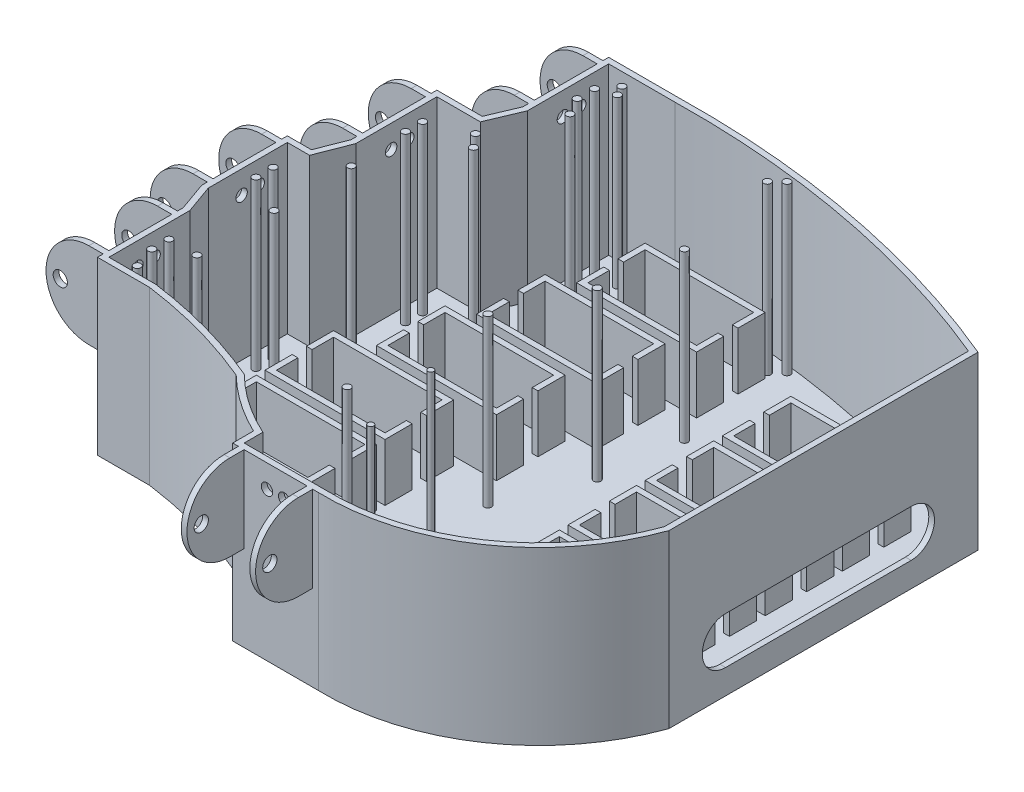
from build123d import *

# Parameters (mm, degrees)
BOSS_EXTRUDE1_DEPTH       = 38.1
CUT_EXTRUDE1_DEPTH        = 36.83
BOSS_EXTRUDE2_DEPTH       = 13.97
BOSS_EXTRUDE3_DEPTH       = 13.97
BOSS_EXTRUDE4_DEPTH       = 13.97
BOSS_EXTRUDE5_DEPTH       = 13.97
BOSS_EXTRUDE6_DEPTH       = 13.97
BOSS_EXTRUDE7_DEPTH       = 13.97
BOSS_EXTRUDE8_DEPTH       = 13.97
BOSS_EXTRUDE9_DEPTH       = 13.97
BOSS_EXTRUDE10_DEPTH      = 13.97
BOSS_EXTRUDE11_DEPTH      = 13.97
SKETCH25_R                = 1.27
THUMB_HOLES_DEPTH         = 12.7
SKETCH31_R                = 1.27
INDEX_FINGER_HOLES_DEPTH  = 17.018
SKETCH32_R                = 1.27
MIDDLE_FINGER_HOLES_DEPTH = 15.24
SKETCH33_R                = 1.27
RING_FINGER_HOLES_DEPTH   = 22.86
SKETCH34_R                = 1.27
PINKY_FINGER_HOLES_DEPTH  = 35.56
SKETCH26_R                = 0.635
SKETCH26_R_2              = 0.79375
GUIDE_POLES_DEPTH         = 36.83
SKETCH35_R                = 1.5875
PINKY_ATTACHMENT_DEPTH    = 19.05
SKETCH36_R                = 1.5875
RING_ATTACHMENT_DEPTH     = 19.05
SKETCH37_R                = 1.5875
MIDDLE_ATTACHMENT_DEPTH   = 19.05
SKETCH38_R                = 1.5875
POINTER_ATTACHMENT_DEPTH  = 19.05
SKETCH39_R                = 1.5875
THUMB_ATTACHMENT_DEPTH    = 19.05
ATTACHMENT_TRIM_DEPTH     = 25.4
CORD_HOLE_DEPTH           = 5.08


with BuildPart() as part:
    # Sketch2 → Boss-Extrude1 (new body)
    with BuildSketch(Plane(origin=(0, 0, 0), x_dir=(1, 0, 0), z_dir=(0, 1, 0))):
        with BuildLine():
            Line((-20.778406205, 52.758673202), (-36.188953289, 52.758673202))
            Line((-36.188953289, 52.758673202), (-36.188953289, 33.708673202))
            Line((-36.188953289, 33.708673202), (-38.864171838, 27.358673202))
            Line((-38.864171838, 27.358673202), (-48.947687906, 27.358673202))
            Line((-48.947687906, 27.358673202), (-48.947687906, 8.308673202))
            Line((-48.947687906, 8.308673202), (-51.417120413, 1.958673202))
            Line((-51.417120413, 1.958673202), (-56.767557511, 1.958673202))
            Line((-56.767557511, 1.958673202), (-56.767557511, -17.091326798))
            Line((-56.767557511, -17.091326798), (-54.503911047, -23.441326798))
            Line((-54.503911047, -23.441326798), (-54.503911047, -42.491326798))
            Line((-54.503911047, -42.491326798), (-42.959403849, -42.491326798))
            ThreePointArc((-42.959403849, -42.491326798), (-29.448791922, -45.239401215), (-16.422067996, -49.755263412))
            ThreePointArc((-16.422067996, -49.755263412), (-10.441569813, -54.6928899), (-3.738179712, -58.593027718))
            Line((-3.738179712, -58.593027718), (-3.738179712, -63.210333869))
            Line((-3.738179712, -63.210333869), (15.311820288, -63.210333869))
            ThreePointArc((15.311820288, -63.210333869), (43.592945253, -54.934630767), (61.572422141, -31.588374066))
            Line((61.572422141, -31.588374066), (61.572422141, 37.055318004))
            ThreePointArc((61.572422141, 37.055318004), (21.220515188, 49.225595088), (-20.778406205, 52.758673202))
        make_face()
    extrude(amount=BOSS_EXTRUDE1_DEPTH)

    # Sketch3 → Cut-Extrude1 (cut)
    with BuildSketch(Plane(origin=(0, 38.1, 0), x_dir=(1, 0, 0), z_dir=(0, 1, 0))):
        with BuildLine():
            Line((-20.193208334, 51.499667825), (-34.918953289, 51.499667825))
            Line((-34.918953289, 51.499667825), (-34.918953289, 33.452072477))
            Line((-34.918953289, 33.452072477), (-38.021111135, 26.088673202))
            Line((-38.021111135, 26.088673202), (-47.677687906, 26.088673202))
            Line((-47.677687906, 26.088673202), (-47.677687906, 8.070420839))
            Line((-47.677687906, 8.070420839), (-50.548353666, 0.688673202))
            Line((-50.548353666, 0.688673202), (-55.497557511, 0.688673202))
            Line((-55.497557511, 0.688673202), (-55.497557511, -16.871730038))
            Line((-55.497557511, -16.871730038), (-53.233911047, -23.221730038))
            Line((-53.233911047, -23.221730038), (-53.233911047, -41.221326798))
            Line((-53.233911047, -41.221326798), (-42.874353316, -41.221326798))
            ThreePointArc((-42.874353316, -41.221326798), (-29.038510393, -44.035017068), (-15.705342229, -48.67980221))
            ThreePointArc((-15.705342229, -48.67980221), (-9.484723257, -53.810670952), (-2.468179712, -57.784338167))
            Line((-2.468179712, -57.784338167), (-2.468179712, -61.940333869))
            Line((-2.468179712, -61.940333869), (15.331165443, -61.940333869))
            ThreePointArc((15.331165443, -61.940333869), (42.778545869, -53.952784334), (60.302422141, -31.367979704))
            Line((60.302422141, -31.367979704), (60.302422141, 36.20914612))
            ThreePointArc((60.302422141, 36.20914612), (20.842965823, 48.004654395), (-20.193208334, 51.499667825))
        make_face()
    extrude(amount=-CUT_EXTRUDE1_DEPTH, mode=Mode.SUBTRACT)

    # Sketch6 → Boss-Extrude2 (add)
    with BuildSketch(Plane(origin=(0, 0, 0), x_dir=(1, 0, 0), z_dir=(0, 1, 0))):
        Polygon((-38.295888343, -32.597001669), (-37.025888343, -32.597001669), (-37.025888343, -37.359501669), (-12.895888343, -37.359501669), (-12.895888343, -32.597001669), (-11.625888343, -32.597001669), (-11.625888343, -38.629501669), (-38.295888343, -38.629501669), align=None)
        Polygon((-12.895888343, -24.659501669), (-37.025888343, -24.659501669), (-37.025888343, -29.422001669), (-38.295888343, -29.422001669), (-38.295888343, -23.389501669), (-11.625888343, -23.389501669), (-11.625888343, -29.422001669), (-12.895888343, -29.422001669), align=None)
    extrude(amount=BOSS_EXTRUDE2_DEPTH)

    # Sketch7 → Boss-Extrude3 (add)
    with BuildSketch(Plane(origin=(0, 0, 0), x_dir=(1, 0, 0), z_dir=(0, 1, 0))):
        Polygon((-38.295888343, -15.452001669), (-37.025888343, -15.452001669), (-37.025888343, -20.214501669), (-12.895888343, -20.214501669), (-12.895888343, -15.452001669), (-11.625888343, -15.452001669), (-11.625888343, -21.484501669), (-38.295888343, -21.484501669), align=None)
        Polygon((-12.895888343, -7.514501669), (-37.025888343, -7.514501669), (-37.025888343, -12.277001669), (-38.295888343, -12.277001669), (-38.295888343, -6.244501669), (-11.625888343, -6.244501669), (-11.625888343, -12.277001669), (-12.895888343, -12.277001669), align=None)
    extrude(amount=BOSS_EXTRUDE3_DEPTH)

    # Sketch15 → Boss-Extrude4 (add)
    with BuildSketch(Plane.XZ):
        Polygon((-30.675888343, -4.867998331), (-29.405888343, -4.867998331), (-29.405888343, -9.630498331), (-5.275888343, -9.630498331), (-5.275888343, -4.867998331), (-4.005888343, -4.867998331), (-4.005888343, -10.900498331), (-30.675888343, -10.900498331), align=None)
        Polygon((-5.275888343, 3.069501669), (-29.405888343, 3.069501669), (-29.405888343, -1.692998331), (-30.675888343, -1.692998331), (-30.675888343, 4.339501669), (-4.005888343, 4.339501669), (-4.005888343, -1.692998331), (-5.275888343, -1.692998331), align=None)
    extrude(amount=-BOSS_EXTRUDE4_DEPTH)

    # Sketch16 → Boss-Extrude5 (add)
    with BuildSketch(Plane.XZ):
        Polygon((-25.595888343, -22.012998331), (-24.325888343, -22.012998331), (-24.325888343, -26.775498331), (-0.195888343, -26.775498331), (-0.195888343, -22.012998331), (1.074111657, -22.012998331), (1.074111657, -28.045498331), (-25.595888343, -28.045498331), align=None)
        Polygon((-0.195888343, -14.075498331), (-24.325888343, -14.075498331), (-24.325888343, -18.837998331), (-25.595888343, -18.837998331), (-25.595888343, -12.805498331), (1.074111657, -12.805498331), (1.074111657, -18.837998331), (-0.195888343, -18.837998331), align=None)
    extrude(amount=-BOSS_EXTRUDE5_DEPTH)

    # Sketch17 → Boss-Extrude6 (add)
    with BuildSketch(Plane.XZ):
        Polygon((-20.515888343, -39.157998331), (-19.245888343, -39.157998331), (-19.245888343, -43.920498331), (4.884111657, -43.920498331), (4.884111657, -39.157998331), (6.154111657, -39.157998331), (6.154111657, -45.190498331), (-20.515888343, -45.190498331), align=None)
        Polygon((4.884111657, -31.220498331), (-19.245888343, -31.220498331), (-19.245888343, -35.982998331), (-20.515888343, -35.982998331), (-20.515888343, -29.950498331), (6.154111657, -29.950498331), (6.154111657, -35.982998331), (4.884111657, -35.982998331), align=None)
    extrude(amount=-BOSS_EXTRUDE6_DEPTH)

    # Sketch18 → Boss-Extrude7 (add)
    with BuildSketch(Plane.XZ):
        Polygon((14.980982224, 42.694916505), (16.250982224, 42.694916505), (16.250982224, 37.932416505), (40.380982224, 37.932416505), (40.380982224, 42.694916505), (41.650982224, 42.694916505), (41.650982224, 36.662416505), (14.980982224, 36.662416505), align=None)
        Polygon((40.380982224, 50.632416505), (16.250982224, 50.632416505), (16.250982224, 45.869916505), (14.980982224, 45.869916505), (14.980982224, 51.902416505), (41.650982224, 51.902416505), (41.650982224, 45.869916505), (40.380982224, 45.869916505), align=None)
    extrude(amount=-BOSS_EXTRUDE7_DEPTH)

    # Sketch19 → Boss-Extrude8 (add)
    with BuildSketch(Plane.XZ):
        Polygon((25.140982224, 25.549916505), (26.410982224, 25.549916505), (26.410982224, 20.787416505), (50.540982224, 20.787416505), (50.540982224, 25.549916505), (51.810982224, 25.549916505), (51.810982224, 19.517416505), (25.140982224, 19.517416505), align=None)
        Polygon((50.540982224, 33.487416505), (26.410982224, 33.487416505), (26.410982224, 28.724916505), (25.140982224, 28.724916505), (25.140982224, 34.757416505), (51.810982224, 34.757416505), (51.810982224, 28.724916505), (50.540982224, 28.724916505), align=None)
    extrude(amount=-BOSS_EXTRUDE8_DEPTH)

    # Sketch20 → Boss-Extrude9 (add)
    with BuildSketch(Plane.XZ):
        Polygon((25.140982224, 8.404916505), (26.410982224, 8.404916505), (26.410982224, 3.642416505), (50.540982224, 3.642416505), (50.540982224, 8.404916505), (51.810982224, 8.404916505), (51.810982224, 2.372416505), (25.140982224, 2.372416505), align=None)
        Polygon((50.540982224, 16.342416505), (26.410982224, 16.342416505), (26.410982224, 11.579916505), (25.140982224, 11.579916505), (25.140982224, 17.612416505), (51.810982224, 17.612416505), (51.810982224, 11.579916505), (50.540982224, 11.579916505), align=None)
    extrude(amount=-BOSS_EXTRUDE9_DEPTH)

    # Sketch21 → Boss-Extrude10 (add)
    with BuildSketch(Plane.XZ):
        Polygon((25.140982224, -8.740083495), (26.410982224, -8.740083495), (26.410982224, -13.502583495), (50.540982224, -13.502583495), (50.540982224, -8.740083495), (51.810982224, -8.740083495), (51.810982224, -14.772583495), (25.140982224, -14.772583495), align=None)
        Polygon((50.540982224, -0.802583495), (26.410982224, -0.802583495), (26.410982224, -5.565083495), (25.140982224, -5.565083495), (25.140982224, 0.467416505), (51.810982224, 0.467416505), (51.810982224, -5.565083495), (50.540982224, -5.565083495), align=None)
    extrude(amount=-BOSS_EXTRUDE10_DEPTH)

    # Sketch22 → Boss-Extrude11 (add)
    with BuildSketch(Plane.XZ):
        Polygon((25.140982224, -25.885083495), (26.410982224, -25.885083495), (26.410982224, -30.647583495), (50.540982224, -30.647583495), (50.540982224, -25.885083495), (51.810982224, -25.885083495), (51.810982224, -31.917583495), (25.140982224, -31.917583495), align=None)
        Polygon((50.540982224, -17.947583495), (26.410982224, -17.947583495), (26.410982224, -22.710083495), (25.140982224, -22.710083495), (25.140982224, -16.677583495), (51.810982224, -16.677583495), (51.810982224, -22.710083495), (50.540982224, -22.710083495), align=None)
    extrude(amount=-BOSS_EXTRUDE11_DEPTH)

    # Sketch25 → Thumb Holes (cut)
    with BuildSketch(Plane.XY.offset(63.5)):
        with Locations((7.691820288, 33.02)):
            Circle(SKETCH25_R)
        with Locations((3.881820288, 33.02)):
            Circle(SKETCH25_R)
    extrude(amount=-THUMB_HOLES_DEPTH, mode=Mode.SUBTRACT)

    # Sketch31 → Index Finger Holes (cut)
    with BuildSketch(Plane(origin=(-69.85, 0, 0), x_dir=(0, 0, -1), z_dir=(1, 0, 0))):
        with Locations((-31.061326798, 33.02)):
            Circle(SKETCH31_R)
        with Locations((-34.871326798, 33.02)):
            Circle(SKETCH31_R)
    extrude(amount=INDEX_FINGER_HOLES_DEPTH, mode=Mode.SUBTRACT)

    # Sketch32 → Middle Finger Holes (cut)
    with BuildSketch(Plane(origin=(-69.85, 0, 0), x_dir=(0, 0, -1), z_dir=(1, 0, 0))):
        with Locations((-9.471326798, 33.02)):
            Circle(SKETCH32_R)
        with Locations((-5.661326798, 33.02)):
            Circle(SKETCH32_R)
    extrude(amount=MIDDLE_FINGER_HOLES_DEPTH, mode=Mode.SUBTRACT)

    # Sketch33 → Ring Finger Holes (cut)
    with BuildSketch(Plane(origin=(-69.85, 0, 0), x_dir=(0, 0, -1), z_dir=(1, 0, 0))):
        with Locations((15.928673202, 33.02)):
            Circle(SKETCH33_R)
        with Locations((19.738673202, 33.02)):
            Circle(SKETCH33_R)
    extrude(amount=RING_FINGER_HOLES_DEPTH, mode=Mode.SUBTRACT)

    # Sketch34 → Pinky Finger Holes (cut)
    with BuildSketch(Plane(origin=(-69.85, 0, 0), x_dir=(0, 0, -1), z_dir=(1, 0, 0))):
        with Locations((41.328673202, 33.02)):
            Circle(SKETCH34_R)
        with Locations((45.181435651, 33.02)):
            Circle(SKETCH34_R)
    extrude(amount=PINKY_FINGER_HOLES_DEPTH, mode=Mode.SUBTRACT)

    # Sketch26 → Guide Poles (add)
    with BuildSketch(Plane(origin=(0, 38.1, 0), x_dir=(1, 0, 0), z_dir=(0, 1, 0))):
        with Locations((8.009320288, -44.282416505)):
            Circle(SKETCH26_R)
        with Locations((4.199320288, -27.137416505)):
            Circle(SKETCH26_R)
        with Locations((-0.26286752, -9.992416505)):
            Circle(SKETCH26_R_2)
        with Locations((6.891203923, 7.152583495)):
            Circle(SKETCH26_R_2)
        with Locations((9.098692406, 24.297583495)):
            Circle(SKETCH26_R_2)
        with Locations((-1.85036752, -39.675840032)):
            Circle(SKETCH26_R_2)
        with Locations((7.511192406, 48.675794749)):
            Circle(SKETCH26_R_2)
        with Locations((5.303703923, 46.519643207)):
            Circle(SKETCH26_R_2)
        with Locations((-48.471411047, -39.675840032)):
            Circle(SKETCH26_R_2)
        with Locations((-52.322557511, -9.471326798)):
            Circle(SKETCH26_R_2)
        with Locations((-52.322557511, -5.661326798)):
            Circle(SKETCH26_R_2)
        with Locations((-43.893096038, -13.864501669)):
            Circle(SKETCH26_R_2)
        with Locations((-43.893096038, 3.280498331)):
            Circle(SKETCH26_R_2)
        with Locations((-33.874140009, 20.425498331)):
            Circle(SKETCH26_R_2)
        with Locations((-44.502687906, 15.928673202)):
            Circle(SKETCH26_R_2)
        with Locations((-29.603786365, 37.570498331)):
            Circle(SKETCH26_R_2)
        with Locations((-36.306573109, 23.2953928)):
            Circle(SKETCH26_R_2)
        with Locations((-44.502687906, 19.738673202)):
            Circle(SKETCH26_R_2)
        with Locations((-28.009949736, 46.519643207)):
            Circle(SKETCH26_R_2)
        with Locations((-29.153323684, 48.675794749)):
            Circle(SKETCH26_R_2)
        with Locations((-31.743953289, 41.328673202)):
            Circle(SKETCH26_R_2)
        with Locations((-31.743953289, 45.181435651)):
            Circle(SKETCH26_R_2)
        with Locations((-50.058911047, -34.871326798)):
            Circle(SKETCH26_R_2)
        with Locations((-50.058911047, -31.061326798)):
            Circle(SKETCH26_R_2)
        with Locations((-43.893096038, -31.009501669)):
            Circle(SKETCH26_R_2)
    extrude(amount=-GUIDE_POLES_DEPTH)

    # Sketch35 → Pinky Attachment (add)
    with BuildSketch(Plane(origin=(0, 0, -52.758673202), x_dir=(-1, 0, 0), z_dir=(0, 0, -1))):
        with BuildLine():
            Line((36.188953289, 38.1), (39.363953289, 38.1))
            ThreePointArc((39.363953289, 38.1), (48.888953289, 28.575), (39.363953289, 19.05))
            Line((39.363953289, 19.05), (36.188953289, 19.05))
            Line((36.188953289, 19.05), (36.188953289, 38.1))
        make_face()
        with Locations((45.713953289, 28.575)):
            Circle(SKETCH35_R, mode=Mode.SUBTRACT)
    extrude(amount=-PINKY_ATTACHMENT_DEPTH)

    # Sketch36 → Ring Attachment (add)
    with BuildSketch(Plane(origin=(0, 0, -27.358673202), x_dir=(-1, 0, 0), z_dir=(0, 0, -1))):
        with BuildLine():
            Line((52.122687906, 38.1), (48.947687906, 38.1))
            Line((48.947687906, 38.1), (48.947687906, 19.05))
            Line((48.947687906, 19.05), (52.122687906, 19.05))
            ThreePointArc((52.122687906, 19.05), (61.647687906, 28.575), (52.122687906, 38.1))
        make_face()
        with Locations((58.472687906, 28.707395517)):
            Circle(SKETCH36_R, mode=Mode.SUBTRACT)
    extrude(amount=-RING_ATTACHMENT_DEPTH)

    # Sketch37 → Middle Attachment (add)
    with BuildSketch(Plane(origin=(0, 0, -1.958673202), x_dir=(-1, 0, 0), z_dir=(0, 0, -1))):
        with BuildLine():
            Line((56.767557511, 38.1), (56.767557511, 19.05))
            Line((56.767557511, 19.05), (59.942557511, 19.05))
            ThreePointArc((59.942557511, 19.05), (69.467557511, 28.575), (59.942557511, 38.1))
            Line((59.942557511, 38.1), (56.767557511, 38.1))
        make_face()
        with Locations((66.292557511, 28.575)):
            Circle(SKETCH37_R, mode=Mode.SUBTRACT)
    extrude(amount=-MIDDLE_ATTACHMENT_DEPTH)

    # Sketch38 → Pointer Attachment (add)
    with BuildSketch(Plane(origin=(0, 0, 23.441326798), x_dir=(-1, 0, 0), z_dir=(0, 0, -1))):
        with BuildLine():
            Line((54.503911047, 38.1), (57.678911047, 38.1))
            ThreePointArc((57.678911047, 38.1), (67.203911047, 28.575), (57.678911047, 19.05))
            Line((57.678911047, 19.05), (54.503911047, 19.05))
            Line((54.503911047, 19.05), (54.503911047, 38.1))
        make_face()
        with Locations((64.028911047, 28.575)):
            Circle(SKETCH38_R, mode=Mode.SUBTRACT)
    extrude(amount=-POINTER_ATTACHMENT_DEPTH)

    # Sketch39 → Thumb Attachment (add)
    with BuildSketch(Plane.ZY.offset(3.738179712)):
        with BuildLine():
            Line((63.210333869, 38.1), (66.385333869, 38.1))
            ThreePointArc((66.385333869, 38.1), (75.910333869, 28.575), (66.385333869, 19.05))
            Line((66.385333869, 19.05), (63.210333869, 19.05))
            Line((63.210333869, 19.05), (63.210333869, 38.1))
        make_face()
        with Locations((72.735333869, 28.575)):
            Circle(SKETCH39_R, mode=Mode.SUBTRACT)
    extrude(amount=-THUMB_ATTACHMENT_DEPTH)

    # Sketch40 → Attachment Trim (cut)
    with BuildSketch(Plane(origin=(0, 38.1, 0), x_dir=(1, 0, 0), z_dir=(0, 1, 0))):
        with BuildLine():
            Line((-1.198179712, -63.210333869), (12.771820288, -63.210333869))
            Line((12.771820288, -63.210333869), (12.771820288, -77.426373828))
            Line((12.771820288, -77.426373828), (14.041820288, -77.426373828))
            Line((14.041820288, -77.426373828), (14.041820288, -63.210333869))
            Line((14.041820288, -63.210333869), (15.311820288, -63.210333869))
            ThreePointArc((15.311820288, -63.210333869), (4.445704746, -84.821396352), (-6.420410797, -63.210333869))
            Line((-6.420410797, -63.210333869), (-2.468179712, -63.210333869))
            Line((-2.468179712, -63.210333869), (-2.468179712, -76.443995802))
            Line((-2.468179712, -76.443995802), (-1.198179712, -76.443995802))
            Line((-1.198179712, -76.443995802), (-1.198179712, -63.210333869))
        make_face()
        with BuildLine():
            Line((-54.503911047, -42.491326798), (-54.503911047, -41.221326798))
            Line((-54.503911047, -41.221326798), (-67.858108769, -41.221326798))
            Line((-67.858108769, -41.221326798), (-67.858108769, -39.951326798))
            Line((-67.858108769, -39.951326798), (-54.503911047, -39.951326798))
            Line((-54.503911047, -39.951326798), (-54.503911047, -25.981326798))
            Line((-54.503911047, -25.981326798), (-68.655515267, -25.981326798))
            Line((-68.655515267, -25.981326798), (-68.655515267, -24.711326798))
            Line((-68.655515267, -24.711326798), (-54.503911047, -24.711326798))
            Line((-54.503911047, -24.711326798), (-54.503911047, -23.441326798))
            ThreePointArc((-54.503911047, -23.441326798), (-74.827366982, -32.966326798), (-54.503911047, -42.491326798))
        make_face()
        with BuildLine():
            Line((-56.767557511, -17.091326798), (-56.767557511, -15.821326798))
            Line((-56.767557511, -15.821326798), (-70.39754909, -15.821326798))
            Line((-70.39754909, -15.821326798), (-70.39754909, -14.551326798))
            Line((-70.39754909, -14.551326798), (-56.767557511, -14.551326798))
            Line((-56.767557511, -14.551326798), (-56.767557511, -0.581326798))
            Line((-56.767557511, -0.581326798), (-71.300395146, -0.581326798))
            Line((-71.300395146, -0.581326798), (-71.300395146, 0.688673202))
            Line((-71.300395146, 0.688673202), (-56.767557511, 0.688673202))
            Line((-56.767557511, 0.688673202), (-56.767557511, 1.958673202))
            ThreePointArc((-56.767557511, 1.958673202), (-76.423750502, -7.566326798), (-56.767557511, -17.091326798))
        make_face()
        with BuildLine():
            Line((-48.947687906, 8.308673202), (-48.947687906, 9.578673202))
            Line((-48.947687906, 9.578673202), (-62.605036811, 9.578673202))
            Line((-62.605036811, 9.578673202), (-62.605036811, 10.848673202))
            Line((-62.605036811, 10.848673202), (-48.947687906, 10.848673202))
            Line((-48.947687906, 10.848673202), (-48.947687906, 24.818673202))
            Line((-48.947687906, 24.818673202), (-63.091078285, 24.818673202))
            Line((-63.091078285, 24.818673202), (-63.091078285, 26.088673202))
            Line((-63.091078285, 26.088673202), (-48.947687906, 26.088673202))
            Line((-48.947687906, 26.088673202), (-48.947687906, 27.358673202))
            ThreePointArc((-48.947687906, 27.358673202), (-66.934227436, 17.833673202), (-48.947687906, 8.308673202))
        make_face()
        with BuildLine():
            Line((-36.188953289, 33.708673202), (-36.188953289, 34.978673202))
            Line((-36.188953289, 34.978673202), (-49.707009775, 34.978673202))
            Line((-49.707009775, 34.978673202), (-49.707009775, 36.248673202))
            Line((-49.707009775, 36.248673202), (-36.188953289, 36.248673202))
            Line((-36.188953289, 36.248673202), (-36.188953289, 50.218673202))
            Line((-36.188953289, 50.218673202), (-49.988806214, 50.218673202))
            Line((-49.988806214, 50.218673202), (-49.988806214, 51.488673202))
            Line((-49.988806214, 51.488673202), (-36.188953289, 51.488673202))
            Line((-36.188953289, 51.488673202), (-36.188953289, 52.758673202))
            ThreePointArc((-36.188953289, 52.758673202), (-55.79651108, 43.233673202), (-36.188953289, 33.708673202))
        make_face()
    extrude(amount=-ATTACHMENT_TRIM_DEPTH, mode=Mode.SUBTRACT)

    # Sketch41 → Cord Hole (cut)
    with BuildSketch(Plane(origin=(62.913848002, 0, 0), x_dir=(0, 0, -1), z_dir=(1, 0, 0))):
        with BuildLine():
            Line((-19.01291879, 15.851932983), (22.200875308, 15.851932983))
            ThreePointArc((22.200875308, 15.851932983), (27.393164329, 10.659643963), (22.200875308, 5.467354942))
            Line((22.200875308, 5.467354942), (-19.01291879, 5.467354942))
            ThreePointArc((-19.01291879, 5.467354942), (-24.20520781, 10.659643963), (-19.01291879, 15.851932983))
        make_face()
    extrude(amount=-CORD_HOLE_DEPTH, mode=Mode.SUBTRACT)


solid = part.part
